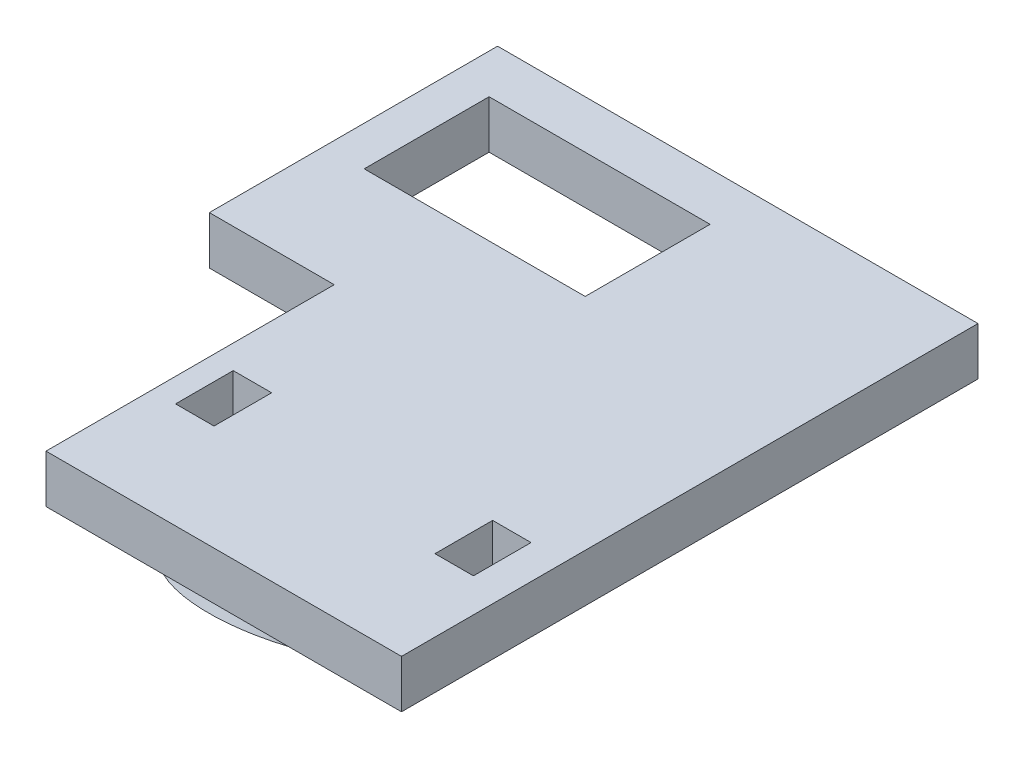
from build123d import *

# Parameters (mm, degrees)
EXTRUDE_1_DEPTH     = 5
SKETCH_3_W          = 23
SKETCH_3_H          = 13
CUT_EXTRUDE_1_DEPTH = 40.37003937
CUT_EXTRUDE_3_REACH = 41.37
SKETCH_4_W          = 4
SKETCH_4_H          = 6
SKETCH_10_R         = 12
EXTRUDE_2_DEPTH     = 5


with BuildPart() as part:
    # 草图1 → 凸台-拉伸1 (new body)
    with BuildSketch(Plane(origin=(0, 0, 0), x_dir=(1, 0, 0), z_dir=(0, 1, 0))):
        Polygon((-12, 0), (-25, 0), (-25, 30), (25, 30), (25, -30), (0, -30), (-12, -30), align=None)
    extrude(amount=EXTRUDE_1_DEPTH)

    # 草图3 → 切除-拉伸1 (cut, through all)
    with BuildSketch(Plane(origin=(0, 5, 0), x_dir=(1, 0, 0), z_dir=(0, 1, 0))):
        with Locations((-9.383841578, 18.5)):
            Rectangle(SKETCH_3_W, SKETCH_3_H)
    extrude(amount=-CUT_EXTRUDE_1_DEPTH, mode=Mode.SUBTRACT)

    # 草图4 → 切除-拉伸3 (cut, up to next)
    with BuildSketch(Plane(origin=(0, 5, 0), x_dir=(1, 0, 0), z_dir=(0, 1, 0)), mode=Mode.PRIVATE) as cut_extrude_3_sk1:
        with Locations((19.484864268, -16)):
            Rectangle(SKETCH_4_W, SKETCH_4_H)
    cut_extrude_3_tool1 = extrude(cut_extrude_3_sk1.sketch, amount=-CUT_EXTRUDE_3_REACH, mode=Mode.PRIVATE) & part.part
    # 草图4 → 切除-拉伸3 (cut, up to next)
    with BuildSketch(Plane(origin=(0, 5, 0), x_dir=(1, 0, 0), z_dir=(0, 1, 0)), mode=Mode.PRIVATE) as cut_extrude_3_sk2:
        with Locations((-7.515135732, -16)):
            Rectangle(SKETCH_4_W, SKETCH_4_H)
    cut_extrude_3_tool2 = extrude(cut_extrude_3_sk2.sketch, amount=-CUT_EXTRUDE_3_REACH, mode=Mode.PRIVATE) & part.part
    add(cut_extrude_3_tool1.solids().sort_by_distance((19.484864, 5, 16))[0], mode=Mode.SUBTRACT)
    add(cut_extrude_3_tool2.solids().sort_by_distance((-7.515136, 5, 16))[0], mode=Mode.SUBTRACT)

    # 放样3: read off the stored shape, not the designer's step
    # 放样3: loft between two sections, ruled curve by curve
    loft_3_from = [
        Edge.make_bspline([(0, 0, -2.31568428), (0.5, 0, -2.31568428), (1.031560811, 0, -2.284671672), (2.154279897, 0, -2.134307508), (2.7456, 0, -2.01488428), (3.9744, 0, -1.65648428), (4.612043934, 0, -1.417312863), (5.904809999, 0, -0.787089406), (6.56, 0, -0.39568428), (7.84, 0, 0.56431572), (8.46462751, 0, 1.133368075), (9.617564271, 0, 2.454441447), (10.14532872, 0, 3.206807069), (11.031141869, 0, 4.867706723), (11.388402367, 0, 5.776150039), (11.873136095, 0, 7.684789092), (12, 0, 8.68431572), (12, 0, 10.68431572), (11.873136095, 0, 11.683842347), (11.388402367, 0, 13.5924814), (11.031141869, 0, 14.500924716), (10.14532872, 0, 16.16182437), (9.617564271, 0, 16.914189993), (8.46462751, 0, 18.235263365), (7.84, 0, 18.80431572), (6.56, 0, 19.76431572), (5.904809999, 0, 20.155720845), (4.612043934, 0, 20.785944302), (3.9744, 0, 21.02511572), (2.7456, 0, 21.38351572), (2.154279897, 0, 21.502938948), (1.031560811, 0, 21.653303111), (0.5, 0, 21.68431572), (-0.5, 0, 21.68431572), (-1.031560811, 0, 21.653303111), (-2.154279897, 0, 21.502938948), (-2.7456, 0, 21.38351572), (-3.9744, 0, 21.02511572), (-4.612043934, 0, 20.785944302), (-5.904809999, 0, 20.155720845), (-6.56, 0, 19.76431572), (-7.84, 0, 18.80431572), (-8.46462751, 0, 18.235263365), (-9.617564271, 0, 16.914189993), (-10.14532872, 0, 16.16182437), (-11.031141869, 0, 14.500924716), (-11.388402367, 0, 13.5924814), (-11.873136095, 0, 11.683842347), (-12, 0, 10.68431572), (-12, 0, 8.68431572), (-11.873136095, 0, 7.684789092), (-11.388402367, 0, 5.776150039), (-11.031141869, 0, 4.867706723), (-10.14532872, 0, 3.206807069), (-9.617564271, 0, 2.454441447), (-8.46462751, 0, 1.133368075), (-7.84, 0, 0.56431572), (-6.56, 0, -0.39568428), (-5.904809999, 0, -0.787089406), (-4.612043934, 0, -1.417312863), (-3.9744, 0, -1.65648428), (-2.7456, 0, -2.01488428), (-2.154279897, 0, -2.134307508), (-1.031560811, 0, -2.284671672), (-0.5, 0, -2.31568428), (0, 0, -2.31568428)], [0, 0, 0, 0, 0.03125, 0.03125, 0.0625, 0.0625, 0.09375, 0.09375, 0.125, 0.125, 0.15625, 0.15625, 0.1875, 0.1875, 0.21875, 0.21875, 0.25, 0.25, 0.28125, 0.28125, 0.3125, 0.3125, 0.34375, 0.34375, 0.375, 0.375, 0.40625, 0.40625, 0.4375, 0.4375, 0.46875, 0.46875, 0.5, 0.5, 0.53125, 0.53125, 0.5625, 0.5625, 0.59375, 0.59375, 0.625, 0.625, 0.65625, 0.65625, 0.6875, 0.6875, 0.71875, 0.71875, 0.75, 0.75, 0.78125, 0.78125, 0.8125, 0.8125, 0.84375, 0.84375, 0.875, 0.875, 0.90625, 0.90625, 0.9375, 0.9375, 0.96875, 0.96875, 1, 1, 1, 1], 3),
    ]
    loft_3_to = [
        Edge.make_bspline([(-0.52761742, -9.581233834, 0.811817288), (-0.028100952, -9.588752826, 0.79115903), (0.504309371, -9.586149748, 0.798310926), (1.632553943, -9.551655339, 0.893083537), (2.228553016, -9.51974195, 0.980764851), (3.471922859, -9.415759146, 1.266455257), (4.119466067, -9.343625689, 1.464640302), (5.438691682, -9.147725615, 2.002871331), (6.110457419, -9.023839373, 2.343245984), (7.431428969, -8.715066178, 3.191593365), (8.080472584, -8.530020165, 3.700003108), (9.290379491, -8.095961256, 4.892570159), (9.850713657, -7.84682242, 5.577073486), (10.808696799, -7.292631477, 7.099700588), (11.205554347, -6.987598513, 7.937771767), (11.773738573, -6.342726221, 9.709543828), (11.944427098, -6.003106357, 10.642641735), (12.032363334, -5.319727582, 12.520209488), (11.94956942, -4.976292164, 13.463790545), (11.549223729, -4.316841038, 15.275617623), (11.232251268, -4.001063121, 16.143210321), (10.420321391, -3.420230493, 17.73903485), (9.926147426, -3.155218632, 18.467148954), (8.83241074, -2.686484038, 19.754986666), (8.233407447, -2.48265175, 20.315011275), (6.996854684, -2.135381321, 21.269128937), (6.359507641, -1.991789608, 21.663643927), (5.095701505, -1.757008348, 22.308700137), (4.469190132, -1.665697135, 22.559575633), (3.257336635, -1.524756986, 22.94680551), (2.671839192, -1.475059075, 23.083349398), (1.556817078, -1.406797807, 23.270895691), (1.027133887, -1.388207525, 23.321972069), (0.028100952, -1.373169543, 23.363288586), (-0.504309371, -1.375772621, 23.35613669), (-1.632553943, -1.41026703, 23.261364079), (-2.228553016, -1.442180418, 23.173682765), (-3.471922859, -1.546163222, 22.887992358), (-4.119466067, -1.61829668, 22.689807314), (-5.438691682, -1.814196753, 22.151576284), (-6.110457419, -1.938082996, 21.811201631), (-7.431428969, -2.24685619, 20.962854251), (-8.080472584, -2.431902204, 20.454444508), (-9.290379491, -2.865961113, 19.261877456), (-9.850713657, -3.115099949, 18.577374129), (-10.808696799, -3.669290892, 17.054747027), (-11.205554347, -3.974323856, 16.216675848), (-11.773738573, -4.619196147, 14.444903788), (-11.944427098, -4.958816011, 13.51180588), (-12.032363334, -5.642194786, 11.634238127), (-11.94956942, -5.985630205, 10.690657071), (-11.549223729, -6.645081331, 8.878829992), (-11.232251268, -6.960859248, 8.011237295), (-10.420321391, -7.541691876, 6.415412766), (-9.926147426, -7.806703737, 5.687298662), (-8.83241074, -8.275438331, 4.399460949), (-8.233407447, -8.479270619, 3.839436341), (-6.996854684, -8.826541048, 2.885318678), (-6.359507641, -8.970132761, 2.490803689), (-5.095701505, -9.204914021, 1.845747479), (-4.469190132, -9.296225234, 1.594871982), (-3.257336635, -9.437165383, 1.207642105), (-2.671839192, -9.486863294, 1.071098218), (-1.556817078, -9.555124562, 0.883551924), (-1.027133887, -9.573714843, 0.832475546), (-0.52761742, -9.581233834, 0.811817288)], [0, 0, 0, 0, 0.03125, 0.03125, 0.0625, 0.0625, 0.09375, 0.09375, 0.125, 0.125, 0.15625, 0.15625, 0.1875, 0.1875, 0.21875, 0.21875, 0.25, 0.25, 0.28125, 0.28125, 0.3125, 0.3125, 0.34375, 0.34375, 0.375, 0.375, 0.40625, 0.40625, 0.4375, 0.4375, 0.46875, 0.46875, 0.5, 0.5, 0.53125, 0.53125, 0.5625, 0.5625, 0.59375, 0.59375, 0.625, 0.625, 0.65625, 0.65625, 0.6875, 0.6875, 0.71875, 0.71875, 0.75, 0.75, 0.78125, 0.78125, 0.8125, 0.8125, 0.84375, 0.84375, 0.875, 0.875, 0.90625, 0.90625, 0.9375, 0.9375, 0.96875, 0.96875, 1, 1, 1, 1], 3),
    ]
    loft_3 = Solid(Shell([*[Face.make_surface_from_curves(loft_3_from[k], loft_3_to[k]) for k in range(1)], Face(Wire(loft_3_from)), Face(Wire(loft_3_to))]))
    add(loft_3)


with BuildPart() as extrude_2_tool:
    # 草图10 → 凸台-拉伸2 (new body)
    with BuildSketch(Plane(origin=(0, -8.721355433, 3.17431378), x_dir=(1, 0, 0), z_dir=(0, -0.9396926207859081, 0.3420201433256695))):
        with Locations(Location((0, 9.474278962, 0), (0, 0, 270))):
            Circle(SKETCH_10_R)
    extrude(amount=EXTRUDE_2_DEPTH)


with BuildPart() as part_1:
    add(part.part)


with BuildPart() as part_2:
    # 凸台-拉伸2: joined with extrude_2_tool
    add(part_1.part.fuse(extrude_2_tool.part, tol=0.00001))


solid = part_2.part
